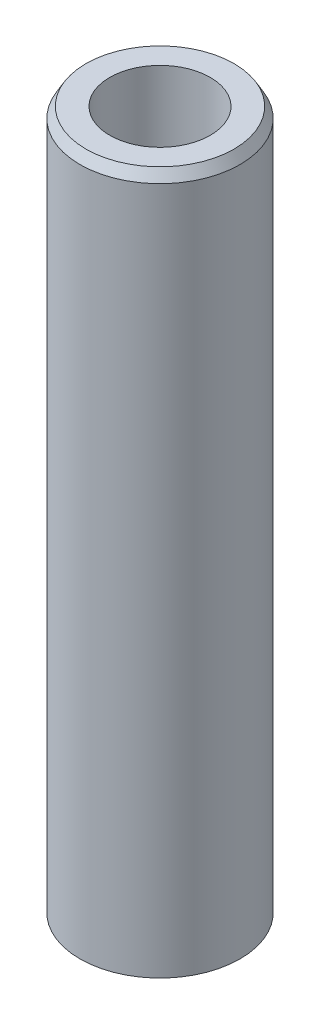
from build123d import *
from OCP.BRepFilletAPI import BRepFilletAPI_MakeChamfer

# Parameters (mm, degrees)
SKETCH1_R           = 7.5
BOSS_EXTRUDE1_DEPTH = 65.990850989
SKETCH2_R           = 4.705946661
CUT_EXTRUDE1_DEPTH  = 67.837806773
CHAMFER1_SIZE       = 0.973951244
CHAMFER1_SIZE2      = 0.562311013


with BuildPart() as part:
    # Sketch1 → Boss-Extrude1 (new body)
    with BuildSketch(Plane(origin=(0, 0, 0), x_dir=(1, 0, 0), z_dir=(0, 1, 0))):
        Circle(SKETCH1_R)
    extrude(amount=BOSS_EXTRUDE1_DEPTH)

    # Sketch2 → Cut-Extrude1 (cut, through all)
    with BuildSketch(Plane(origin=(0, 0, 0), x_dir=(1, 0, 0), z_dir=(0, 1, 0))):
        Circle(SKETCH2_R)
    extrude(amount=CUT_EXTRUDE1_DEPTH, mode=Mode.SUBTRACT)

    # Chamfer1: one chamfer whose edges measure the first distance from different faces: ONE call of the kernel's chamfer builder (chamfer() names one face for all edges)
    chamfer1_edges_1 = [part.edges().sort_by_distance(p)[0] for p in [
        (-7.5, 65.990850989, 0),
    ]]
    chamfer1_side_1 = [part.faces().sort_by_distance(p)[0] for p in [
        (-7.5, 32.995425495, 0),
    ]]
    chamfer1_edges_2 = [part.edges().sort_by_distance(p)[0] for p in [
        (-7.5, 0, 0),
    ]]
    chamfer1_side_2 = [part.faces().sort_by_distance(p)[0] for p in [
        (-7.287867966, 0, 0),
    ]]
    chamfer1 = BRepFilletAPI_MakeChamfer(part.part.solid().wrapped)
    for e in chamfer1_edges_1:
        chamfer1.Add(CHAMFER1_SIZE, CHAMFER1_SIZE2, e.wrapped, chamfer1_side_1[0].wrapped)  # the first distance lies on this face
    for e in chamfer1_edges_2:
        chamfer1.Add(CHAMFER1_SIZE, CHAMFER1_SIZE2, e.wrapped, chamfer1_side_2[0].wrapped)  # the first distance lies on this face
    add(Compound.cast(chamfer1.Shape()), mode=Mode.REPLACE)


solid = part.part
